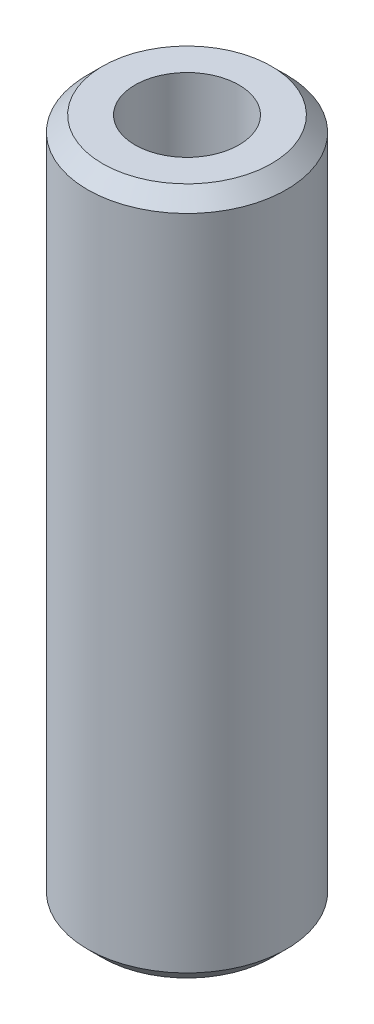
from build123d import *

# Parameters (mm, degrees)
SKETCH1_R           = 32.5
BOSS_EXTRUDE1_DEPTH = 224.734660975
SKETCH2_R           = 16.988648898
CUT_EXTRUDE1_DEPTH  = 230.386503185
CHAMFER1_SIZE       = 4.906954354


with BuildPart() as part:
    # Sketch1 → Boss-Extrude1 (new body)
    with BuildSketch(Plane(origin=(0, 0, 0), x_dir=(1, 0, 0), z_dir=(0, 1, 0))):
        Circle(SKETCH1_R)
    extrude(amount=BOSS_EXTRUDE1_DEPTH)

    # Sketch2 → Cut-Extrude1 (cut, through all)
    with BuildSketch(Plane(origin=(0, 0, 0), x_dir=(1, 0, 0), z_dir=(0, 1, 0))):
        Circle(SKETCH2_R)
    extrude(amount=CUT_EXTRUDE1_DEPTH, mode=Mode.SUBTRACT)

    # Chamfer1
    chamfer1_edges = [part.edges().sort_by_distance(p)[0] for p in [
        (-32.5, 224.734660975, 0),
        (-32.5, 0, 0),
    ]]
    chamfer(chamfer1_edges, length=CHAMFER1_SIZE)


solid = part.part
